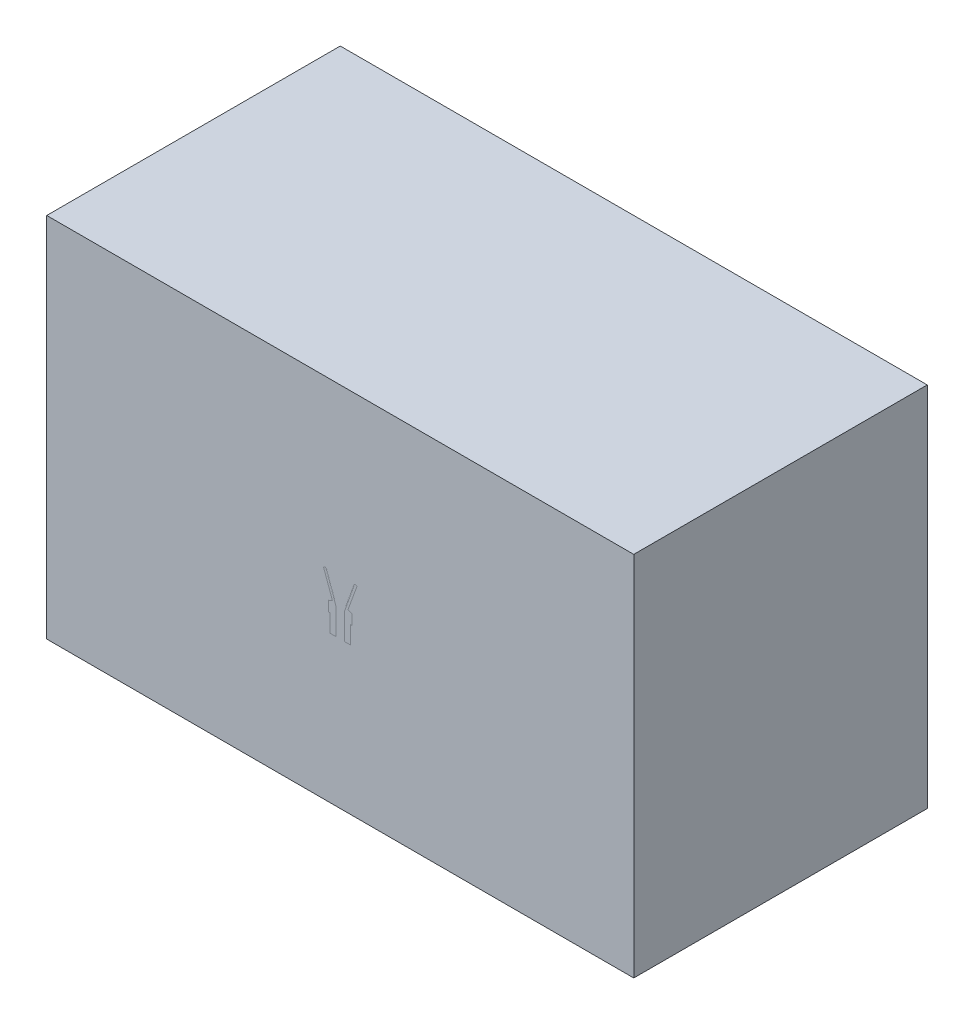
from build123d import *

# Parameters (mm, degrees)
SKETCH1_R           = 175
SKETCH1_R_2         = 75
BOSS_EXTRUDE1_DEPTH = 457
SKETCH3_W           = 10160
SKETCH3_H           = 6350
BOSS_EXTRUDE2_DEPTH = 5080
SKETCH4_W           = 13475.768327993
SKETCH4_H           = 8367.586519284
CUT_EXTRUDE1_DEPTH  = 8132.96778154


# Read off the part's stored shape, not the designer's step: Intersect1
with BuildPart() as part:
    # Sketch1 → Boss-Extrude1 (new body)
    with BuildSketch(Plane(origin=(0, 0, 0), x_dir=(1, 0, 0), z_dir=(0, 1, 0))):
        with Locations(Location((0, 0, 0), (0, 0, 270))):
            Circle(SKETCH1_R)
        with Locations(Location((0, 0, 0), (0, 0, 270))):
            Circle(SKETCH1_R_2, mode=Mode.SUBTRACT)
    extrude(amount=BOSS_EXTRUDE1_DEPTH)

    # Sketch2 → Revolve1 (revolve)
    with BuildSketch(Plane.XY, mode=Mode.PRIVATE) as revolve1_sk:
        Polygon((-175, 307), (-200.4, 307), (-200.4, 482.4), (-139.277313963, 504.646838356), (-135.239195295, 511.108881193), (-289.992827219, 936.290990481), (-254.190538367, 949.321957942), (-249.846882546, 937.387861658), (-239.178882546, 941.270696117), (-232.245249584, 922.220696117), (-242.913249584, 918.337861658), (-236.397765853, 900.436717232), (-225.729765853, 904.319551691), (-218.79613289, 885.269551691), (-229.46413289, 881.386717232), (-222.530499928, 862.336717232), (-211.862499928, 866.219551691), (-204.928866965, 847.169551691), (-215.596866965, 843.286717232), (-208.663234002, 824.236717232), (-197.995234002, 828.119551691), (-191.061601039, 809.069551691), (-201.729601039, 805.186717232), (-194.795968077, 786.136717232), (-184.127968077, 790.019551691), (-177.194335114, 770.969551691), (-187.862335114, 767.086717232), (-180.928702151, 748.036717232), (-170.260702151, 751.919551691), (-163.327069188, 732.869551691), (-173.995069188, 728.986717232), (-167.061436225, 709.936717232), (-156.393436225, 713.819551691), (-149.459803263, 694.769551691), (-160.127803263, 690.886717232), (-153.1941703, 671.836717232), (-142.5261703, 675.719551691), (-136.01068657, 657.818407265), (-146.67868657, 653.935572806), (-139.745053607, 634.885572806), (-129.077053607, 638.768407265), (-122.143420644, 619.718407265), (-132.811420644, 615.835572806), (-125.877787681, 596.785572806), (-115.209787681, 600.668407265), (-108.276154719, 581.618407265), (-118.944154719, 577.735572806), (-112.010521756, 558.685572806), (-101.342521756, 562.568407265), (-94.408888793, 543.518407265), (-105.076888793, 539.635572806), (-101.061934921, 528.604577704), (-75, 457), (-175, 457), align=None)
    revolve(revolve1_sk.sketch.rotate(Axis((0, 0, 0), (0, 1, 0)), 270), axis=Axis((0, 0, 0), (0, 1, 0)))


with BuildPart() as body_2:
    # Sketch3 → Boss-Extrude2 (new, symmetric)
    with BuildSketch(Plane(origin=(0, 0, 0), x_dir=(0, 0, -1), z_dir=(1, 0, 0))):
        with Locations((0, 635)):
            Rectangle(SKETCH3_W, SKETCH3_H)
    extrude(amount=BOSS_EXTRUDE2_DEPTH, both=True)

    # Intersect1 outline → Intersect1 (revolve, cut)
    with BuildSketch(Plane.XY):
        Polygon((105.076888793, 539.635572806), (75, 457), (75, 0), (175, 0), (175, 307), (200.4, 307), (200.4, 482.4), (139.277313963, 504.646838356), (135.239195295, 511.108881193), (289.992827219, 936.290990481), (254.190538367, 949.321957942), (249.846882546, 937.387861658), (239.178882546, 941.270696117), (232.245249584, 922.220696117), (242.913249584, 918.337861658), (236.397765853, 900.436717232), (225.729765853, 904.319551691), (218.79613289, 885.269551691), (229.46413289, 881.386717232), (222.530499928, 862.336717232), (211.862499928, 866.219551691), (204.928866965, 847.169551691), (215.596866965, 843.286717232), (208.663234002, 824.236717232), (197.995234002, 828.119551691), (191.061601039, 809.069551691), (201.729601039, 805.186717232), (194.795968077, 786.136717232), (184.127968077, 790.019551691), (177.194335114, 770.969551691), (187.862335114, 767.086717232), (180.928702151, 748.036717232), (170.260702151, 751.919551691), (163.327069188, 732.869551691), (173.995069188, 728.986717232), (167.061436225, 709.936717232), (156.393436225, 713.819551691), (149.459803263, 694.769551691), (160.127803263, 690.886717232), (153.1941703, 671.836717232), (142.5261703, 675.719551691), (136.01068657, 657.818407265), (146.67868657, 653.935572806), (139.745053607, 634.885572806), (129.077053607, 638.768407265), (122.143420644, 619.718407265), (132.811420644, 615.835572806), (125.877787681, 596.785572806), (115.209787681, 600.668407265), (108.276154719, 581.618407265), (118.944154719, 577.735572806), (112.010521756, 558.685572806), (101.342521756, 562.568407265), (94.408888793, 543.518407265), align=None)
    revolve(axis=Axis((0, 0, 0), (0, 1, 0)), mode=Mode.SUBTRACT)


with BuildPart() as cut_extrude1_tool:
    # Sketch4 → Cut-Extrude1 (new, through all)
    with BuildSketch(Plane.XY):
        with Locations((454.179344916, 464.014834855)):
            Rectangle(SKETCH4_W, SKETCH4_H)
    extrude(amount=CUT_EXTRUDE1_DEPTH)


with BuildPart() as part_1:
    add(part.part)

    # Cut-Extrude1: cut by cut_extrude1_tool
    add(cut_extrude1_tool.part, mode=Mode.SUBTRACT)


with BuildPart() as body_2_1:
    add(body_2.part)

    # Cut-Extrude1: cut by cut_extrude1_tool
    add(cut_extrude1_tool.part, mode=Mode.SUBTRACT)


solid = Compound([part_1.part, body_2_1.part])
